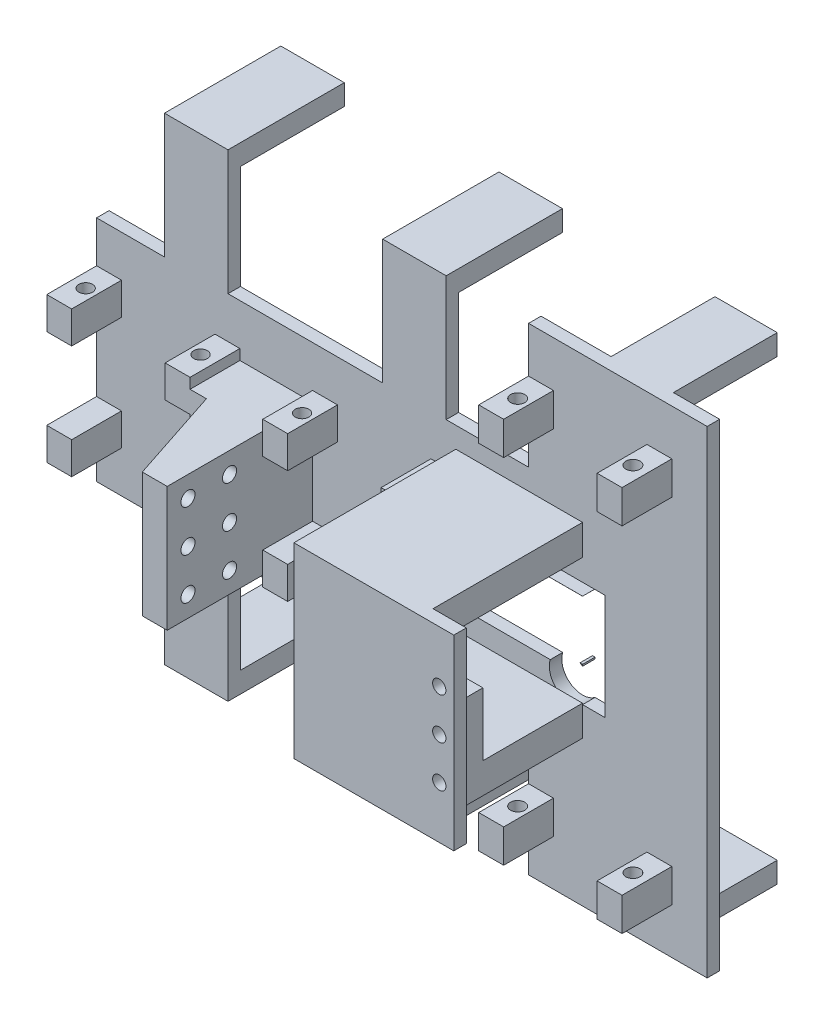
from build123d import *

# Parameters (mm, degrees)
SKETCH1_W                      = 117
SKETCH1_H                      = 3
BOSS_EXTRUDE1_DEPTH            = 22.5
SKETCH2_W                      = 6
SKETCH2_H                      = 4
SKETCH2_H_2                    = 3.739195524
BOSS_EXTRUDE2_DEPTH            = 12
SKETCH4_R                      = 1.65
CUT_EXTRUDE1_DEPTH             = 4
SKETCH5_W                      = 20
SKETCH5_H                      = 3
SKETCH5_W_2                    = 46
SKETCH5_W_3                    = 10.006606548
BOSS_EXTRUDE3_DEPTH            = 5
SKETCH6_W                      = 6
SKETCH6_H                      = 15
BOSS_EXTRUDE4_DEPTH            = 35
BOSS_EXTRUDE5_DEPTH            = 30
SKETCH7_R                      = 1.7
CUT_EXTRUDE2_DEPTH             = 6
CUT_EXTRUDE2_DIRECTION_2_REACH = 88.84
CUT_EXTRUDE3_DEPTH             = 9
BOSS_EXTRUDE6_START            = -5
SKETCH11_W                     = 8
SKETCH11_H                     = 3
BOSS_EXTRUDE6_DEPTH            = 45
CUT_EXTRUDE4_REACH             = 89.07
SKETCH12_R                     = 1.6
SKETCH13_W                     = 24
SKETCH13_H                     = 30.4
CUT_EXTRUDE5_DEPTH             = 30
SKETCH14_W                     = 9.468860996
SKETCH14_H                     = 15.2
SKETCH14_W_2                   = 1.664273207
CUT_EXTRUDE6_DEPTH             = 10
SKETCH15_R                     = 5
CUT_EXTRUDE7_DEPTH             = 3
SKETCH16_R                     = 1.6
CUT_EXTRUDE8_DEPTH             = 4
CUT_EXTRUDE9_REACH             = 89.07
SKETCH17_W                     = 4.98845927
SKETCH17_H                     = 2.1
SKETCH18_W                     = 14
SKETCH18_H                     = 5
BOSS_EXTRUDE7_DEPTH            = 25
SKETCH19_W                     = 15.287657906
SKETCH19_H                     = 3
SKETCH19_W_2                   = 15.287657905
BOSS_EXTRUDE8_DEPTH            = 30
SKETCH20_W                     = 15.287657905
SKETCH20_H                     = 4.97865041
SKETCH20_W_2                   = 15.287657906
BOSS_EXTRUDE9_DEPTH            = 25
SKETCH22_W                     = 3
SKETCH22_H                     = 17.5
SKETCH22_H_2                   = 12
BOSS_EXTRUDE10_DEPTH           = 30
BOSS_EXTRUDE11_REACH           = 122.836
SKETCH23_W                     = 24.559311465
SKETCH23_H                     = 3
SKETCH24_W                     = 43
SKETCH24_H                     = 30.001911063
BOSS_EXTRUDE12_DEPTH           = 3
SKETCH25_W                     = 6
SKETCH25_H                     = 8
BOSS_EXTRUDE13_DEPTH           = 12
SKETCH26_R                     = 1.7
CUT_EXTRUDE10_DEPTH            = 8
SKETCH27_W                     = 15
SKETCH27_H                     = 5
BOSS_EXTRUDE14_DEPTH           = 28
MIRROR3_START                  = -62.501911063
MIRROR3_OUTLINE_W              = 43
MIRROR3_OUTLINE_H              = 3
MIRROR3_DEPTH                  = 30.001911063
MIRROR3_2_OUTLINE_W            = 15
MIRROR3_2_OUTLINE_H            = 25
MIRROR3_2_DEPTH                = 5
MIRROR3_START_2                = -51.5
MIRROR3_3_OUTLINE_W            = 6
MIRROR3_3_OUTLINE_H            = 12
MIRROR3_3_OUTLINE_R            = 1.7
MIRROR3_3_DEPTH                = 8


# Read off the part's stored shape, not the designer's step: Mirror3
with BuildPart() as part:
    # Sketch1 → Boss-Extrude1 (new body)
    with BuildSketch(Plane(origin=(0, 0, 0), x_dir=(1, 0, 0), z_dir=(0, 1, 0))):
        with Locations((2.5, -1.5)):
            Rectangle(SKETCH1_W, SKETCH1_H)
    extrude(amount=BOSS_EXTRUDE1_DEPTH)

    # Sketch2 → Boss-Extrude2 (add)
    with BuildSketch(Plane.XY.offset(3)):
        with Locations((-1, 10.5)):
            Rectangle(SKETCH2_W, SKETCH2_H)
        with Locations((27.5, 10.5)):
            Rectangle(SKETCH2_W, SKETCH2_H)
        with Locations((-24.5, 10.5)):
            Rectangle(SKETCH2_W, SKETCH2_H)
        with Locations((-53, 10.5)):
            Rectangle(SKETCH2_W, SKETCH2_H)
        with Locations((-53, 6.630402238)):
            Rectangle(SKETCH2_W, SKETCH2_H_2)
        with Locations((-24.5, 6.630402238)):
            Rectangle(SKETCH2_W, SKETCH2_H_2)
        with Locations((-1, 6.630402238)):
            Rectangle(SKETCH2_W, SKETCH2_H_2)
        with Locations((27.5, 6.630402238)):
            Rectangle(SKETCH2_W, SKETCH2_H_2)
    extrude(amount=BOSS_EXTRUDE2_DEPTH)

    # Sketch4 → Cut-Extrude1 (cut)
    with BuildSketch(Plane(origin=(0, 12.5, 0), x_dir=(1, 0, 0), z_dir=(0, 1, 0))):
        with Locations(Location((-52.625, -9, 0), (0, 0, 180))):
            Circle(SKETCH4_R)
        with Locations(Location((-24.967056107, -9, 0), (0, 0, 180))):
            Circle(SKETCH4_R)
        with Locations(Location((-0.532943893, -9, 0), (0, 0, 180))):
            Circle(SKETCH4_R)
        with Locations(Location((27.125, -9, 0), (0, 0, 180))):
            Circle(SKETCH4_R)
    extrude(amount=-CUT_EXTRUDE1_DEPTH, mode=Mode.SUBTRACT)

    # Sketch5 → Boss-Extrude3 (add)
    with BuildSketch(Plane(origin=(0, 0, 0), x_dir=(-1, 0, 0), z_dir=(0, -1, 0))):
        with Locations((0, -1.5)):
            Rectangle(SKETCH5_W, SKETCH5_H)
        with Locations((33, -1.5)):
            Rectangle(SKETCH5_W_2, SKETCH5_H)
        with Locations((-15.003303274, -1.5)):
            Rectangle(SKETCH5_W_3, SKETCH5_H)
    extrude(amount=BOSS_EXTRUDE3_DEPTH)

    # Sketch6 → Boss-Extrude4 (add)
    with BuildSketch(Plane.XY.offset(3)):
        with Locations((-7, 2.5)):
            Rectangle(SKETCH6_W, SKETCH6_H)
    extrude(amount=BOSS_EXTRUDE4_DEPTH)

    # Mirror1: part across plane


with BuildPart() as part_1:
    add(part.part)
    add(part.part.mirror(Plane(origin=(0, -5, 0), x_dir=(0, 0, 1), z_dir=(0, -1, 0))))

    # Sketch8 → Boss-Extrude5 (add)
    with BuildSketch(Plane.XZ.offset(20)):
        Polygon((-10, 3), (-10, 38), (-17.557142857, 15), (-21.5, 15), (-21.5, 3), align=None)
    extrude(amount=-BOSS_EXTRUDE5_DEPTH)

    # Sketch7 → Cut-Extrude2 (cut)
    with BuildSketch(Plane.ZY.offset(10)):
        with Locations((23, 5)):
            Circle(SKETCH7_R)
        with Locations((33, 5)):
            Circle(SKETCH7_R)
        with Locations((23, -5)):
            Circle(SKETCH7_R)
        with Locations((33, -5)):
            Circle(SKETCH7_R)
        with Locations((33, -15)):
            Circle(SKETCH7_R)
        with Locations((23, -15)):
            Circle(SKETCH7_R)
    extrude(amount=-CUT_EXTRUDE2_DEPTH, mode=Mode.SUBTRACT)

    # Cut-Extrude2 direction 2: up to this plane
    cut_extrude2_direction_2_end = Plane(origin=(-20.294713575, 10, 6.668263032), z_dir=(-0.9500317490404901, 0, 0.3121532889704468))
    # Sketch7 → Cut-Extrude2 direction 2 (cut, up to the surface)
    with BuildSketch(Plane.ZY.offset(10), mode=Mode.PRIVATE) as cut_extrude2_direction_2_sk1:
        with Locations((23, 5)):
            Circle(SKETCH7_R)
    cut_extrude2_direction_2_tool1 = split(extrude(cut_extrude2_direction_2_sk1.sketch, amount=CUT_EXTRUDE2_DIRECTION_2_REACH, mode=Mode.PRIVATE), bisect_by=cut_extrude2_direction_2_end, keep=Keep.BOTH, mode=Mode.PRIVATE)
    add(cut_extrude2_direction_2_tool1.solids().sort_by_distance((-10, 5, 23))[0], mode=Mode.SUBTRACT)
    # Sketch7 → Cut-Extrude2 direction 2 (cut, up to the surface)
    with BuildSketch(Plane.ZY.offset(10), mode=Mode.PRIVATE) as cut_extrude2_direction_2_sk2:
        with Locations((33, 5)):
            Circle(SKETCH7_R)
    cut_extrude2_direction_2_tool2 = split(extrude(cut_extrude2_direction_2_sk2.sketch, amount=CUT_EXTRUDE2_DIRECTION_2_REACH, mode=Mode.PRIVATE), bisect_by=cut_extrude2_direction_2_end, keep=Keep.BOTH, mode=Mode.PRIVATE)
    add(cut_extrude2_direction_2_tool2.solids().sort_by_distance((-10, 5, 33))[0], mode=Mode.SUBTRACT)
    # Sketch7 → Cut-Extrude2 direction 2 (cut, up to the surface)
    with BuildSketch(Plane.ZY.offset(10), mode=Mode.PRIVATE) as cut_extrude2_direction_2_sk3:
        with Locations((23, -5)):
            Circle(SKETCH7_R)
    cut_extrude2_direction_2_tool3 = split(extrude(cut_extrude2_direction_2_sk3.sketch, amount=CUT_EXTRUDE2_DIRECTION_2_REACH, mode=Mode.PRIVATE), bisect_by=cut_extrude2_direction_2_end, keep=Keep.BOTH, mode=Mode.PRIVATE)
    add(cut_extrude2_direction_2_tool3.solids().sort_by_distance((-10, -5, 23))[0], mode=Mode.SUBTRACT)
    # Sketch7 → Cut-Extrude2 direction 2 (cut, up to the surface)
    with BuildSketch(Plane.ZY.offset(10), mode=Mode.PRIVATE) as cut_extrude2_direction_2_sk4:
        with Locations((33, -5)):
            Circle(SKETCH7_R)
    cut_extrude2_direction_2_tool4 = split(extrude(cut_extrude2_direction_2_sk4.sketch, amount=CUT_EXTRUDE2_DIRECTION_2_REACH, mode=Mode.PRIVATE), bisect_by=cut_extrude2_direction_2_end, keep=Keep.BOTH, mode=Mode.PRIVATE)
    add(cut_extrude2_direction_2_tool4.solids().sort_by_distance((-10, -5, 33))[0], mode=Mode.SUBTRACT)
    # Sketch7 → Cut-Extrude2 direction 2 (cut, up to the surface)
    with BuildSketch(Plane.ZY.offset(10), mode=Mode.PRIVATE) as cut_extrude2_direction_2_sk5:
        with Locations((33, -15)):
            Circle(SKETCH7_R)
    cut_extrude2_direction_2_tool5 = split(extrude(cut_extrude2_direction_2_sk5.sketch, amount=CUT_EXTRUDE2_DIRECTION_2_REACH, mode=Mode.PRIVATE), bisect_by=cut_extrude2_direction_2_end, keep=Keep.BOTH, mode=Mode.PRIVATE)
    add(cut_extrude2_direction_2_tool5.solids().sort_by_distance((-10, -15, 33))[0], mode=Mode.SUBTRACT)
    # Sketch7 → Cut-Extrude2 direction 2 (cut, up to the surface)
    with BuildSketch(Plane.ZY.offset(10), mode=Mode.PRIVATE) as cut_extrude2_direction_2_sk6:
        with Locations((23, -15)):
            Circle(SKETCH7_R)
    cut_extrude2_direction_2_tool6 = split(extrude(cut_extrude2_direction_2_sk6.sketch, amount=CUT_EXTRUDE2_DIRECTION_2_REACH, mode=Mode.PRIVATE), bisect_by=cut_extrude2_direction_2_end, keep=Keep.BOTH, mode=Mode.PRIVATE)
    add(cut_extrude2_direction_2_tool6.solids().sort_by_distance((-10, -15, 23))[0], mode=Mode.SUBTRACT)

    # Sketch10 → Cut-Extrude3 (cut)
    with BuildSketch(Plane.ZY.offset(20)):
        Polygon((26.348631561, 5), (24.674315781, 7.9), (21.325684219, 7.9), (19.651368439, 5), (21.325684219, 2.1), (24.674315781, 2.1), align=None)
        Polygon((36.348631561, 5), (34.674315781, 7.9), (31.325684219, 7.9), (29.651368439, 5), (31.325684219, 2.1), (34.674315781, 2.1), align=None)
        Polygon((36.348631561, -5), (34.674315781, -2.1), (31.325684219, -2.1), (29.651368439, -5), (31.325684219, -7.9), (34.674315781, -7.9), align=None)
        Polygon((26.348631561, -5), (24.674315781, -2.1), (21.325684219, -2.1), (19.651368439, -5), (21.325684219, -7.9), (24.674315781, -7.9), align=None)
        Polygon((34.674315781, -12.1), (36.348631561, -15), (34.674315781, -17.9), (31.325684219, -17.9), (29.651368439, -15), (31.325684219, -12.1), align=None)
        Polygon((24.674315781, -12.1), (26.348631561, -15), (24.674315781, -17.9), (21.325684219, -17.9), (19.651368439, -15), (21.325684219, -12.1), align=None)
    extrude(amount=-CUT_EXTRUDE3_DEPTH, mode=Mode.SUBTRACT)

    # Sketch11 → Boss-Extrude6 (add)
    with BuildSketch(Plane.XZ.offset(32.5).offset(BOSS_EXTRUDE6_START)):
        Polygon((57, 42), (30.5, 15), (30.5, 3), (61, 3), (61, 39), (61, 42), align=None)
        with Locations((65, 40.5)):
            Rectangle(SKETCH11_W, SKETCH11_H)
        Polygon((30.5, 42), (57, 42), (30.5, 15), align=None)
    extrude(amount=-BOSS_EXTRUDE6_DEPTH)

    # Sketch12 → Cut-Extrude4 (cut, up to next)
    with BuildSketch(Plane.XY.offset(42), mode=Mode.PRIVATE) as cut_extrude4_sk1:
        with Locations((65.5, 5)):
            Circle(SKETCH12_R)
    cut_extrude4_tool1 = extrude(cut_extrude4_sk1.sketch, amount=-CUT_EXTRUDE4_REACH, mode=Mode.PRIVATE) & part_1.part
    # Sketch12 → Cut-Extrude4 (cut, up to next)
    with BuildSketch(Plane.XY.offset(42), mode=Mode.PRIVATE) as cut_extrude4_sk2:
        with Locations((65.5, -5)):
            Circle(SKETCH12_R)
    cut_extrude4_tool2 = extrude(cut_extrude4_sk2.sketch, amount=-CUT_EXTRUDE4_REACH, mode=Mode.PRIVATE) & part_1.part
    # Sketch12 → Cut-Extrude4 (cut, up to next)
    with BuildSketch(Plane.XY.offset(42), mode=Mode.PRIVATE) as cut_extrude4_sk3:
        with Locations((65.5, -15)):
            Circle(SKETCH12_R)
    cut_extrude4_tool3 = extrude(cut_extrude4_sk3.sketch, amount=-CUT_EXTRUDE4_REACH, mode=Mode.PRIVATE) & part_1.part
    add(cut_extrude4_tool1.solids().sort_by_distance((65.5, 5, 42))[0], mode=Mode.SUBTRACT)
    add(cut_extrude4_tool2.solids().sort_by_distance((65.5, -5, 42))[0], mode=Mode.SUBTRACT)
    add(cut_extrude4_tool3.solids().sort_by_distance((65.5, -15, 42))[0], mode=Mode.SUBTRACT)

    # Sketch13 → Cut-Extrude5 (cut)
    with BuildSketch(Plane(origin=(61, 0, 0), x_dir=(0, 0, -1), z_dir=(1, 0, 0))):
        with Locations((-15, -5)):
            Rectangle(SKETCH13_W, SKETCH13_H)
    extrude(amount=-CUT_EXTRUDE5_DEPTH, mode=Mode.SUBTRACT)

    # Sketch14 → Cut-Extrude6 (cut)
    with BuildSketch(Plane(origin=(61, 0, 0), x_dir=(0, 0, -1), z_dir=(1, 0, 0))):
        with Locations((-31.734430498, 2.6)):
            Rectangle(SKETCH14_W, SKETCH14_H)
        with Locations((-37.3009976, 2.6)):
            Rectangle(SKETCH14_W_2, SKETCH14_H)
    extrude(amount=-CUT_EXTRUDE6_DEPTH, mode=Mode.SUBTRACT)

    # Sketch15 → Cut-Extrude7 (cut)
    with BuildSketch(Plane(origin=(0, 0, 0), x_dir=(-1, 0, 0), z_dir=(0, 0, -1))):
        with Locations((-34, 6.5)):
            Circle(SKETCH15_R)
        with Locations((-58, -16.5)):
            Circle(SKETCH15_R)
    extrude(amount=-CUT_EXTRUDE7_DEPTH, mode=Mode.SUBTRACT)

    # Sketch16 → Cut-Extrude8 (cut)
    with BuildSketch(Plane(origin=(0, 0, 27), x_dir=(-1, 0, 0), z_dir=(0, 0, -1))):
        with Locations((-58, -16.5)):
            Circle(SKETCH16_R)
        with Locations((-34, 6.5)):
            Circle(SKETCH16_R)
    extrude(amount=-CUT_EXTRUDE8_DEPTH, mode=Mode.SUBTRACT)

    # Sketch17 → Cut-Extrude9 (cut, up to next)
    with BuildSketch(Plane(origin=(0, 0, 0), x_dir=(-1, 0, 0), z_dir=(0, 0, -1)), mode=Mode.PRIVATE) as cut_extrude9_sk1:
        with BuildLine():
            ThreePointArc((-36, 1.917424305), (-36.189338231, 2.004802773), (-36.374868417, 2.1))
            Line((-36.374868417, 2.1), (-61, 2.1))
            Line((-61, 2.1), (-61, 0))
            Line((-61, 0), (-36, 0))
            Line((-36, 0), (-36, 1.917424305))
        make_face()
    cut_extrude9_tool1 = extrude(cut_extrude9_sk1.sketch, amount=-CUT_EXTRUDE9_REACH, mode=Mode.PRIVATE) & part_1.part
    # Sketch17 → Cut-Extrude9 (cut, up to next)
    with BuildSketch(Plane(origin=(0, 0, 0), x_dir=(-1, 0, 0), z_dir=(0, 0, -1)), mode=Mode.PRIVATE) as cut_extrude9_sk2:
        with BuildLine():
            Line((-61, 2.111321556), (-36.395725675, 2.111321556))
            ThreePointArc((-36.395725675, 2.111321556), (-37.862891761, 3.325402823), (-38.769696007, 5))
            Line((-38.769696007, 5), (-61, 5))
            Line((-61, 5), (-61, 2.111321556))
        make_face()
    cut_extrude9_tool2 = extrude(cut_extrude9_sk2.sketch, amount=-CUT_EXTRUDE9_REACH, mode=Mode.PRIVATE) & part_1.part
    # Sketch17 → Cut-Extrude9 (cut, up to next)
    with BuildSketch(Plane(origin=(0, 0, 0), x_dir=(-1, 0, 0), z_dir=(0, 0, -1)), mode=Mode.PRIVATE) as cut_extrude9_sk3:
        with BuildLine():
            ThreePointArc((-31.606750593, 2.109970697), (-33.781071239, 1.50479528), (-36, 1.917424305))
            Line((-36, 1.917424305), (-36, 0))
            Line((-36, 0), (-31.01154073, 0))
            Line((-31.01154073, 0), (-31.01154073, 2.111321556))
            Line((-31.01154073, 2.111321556), (-31.606750593, 2.109970697))
        make_face()
    cut_extrude9_tool3 = extrude(cut_extrude9_sk3.sketch, amount=-CUT_EXTRUDE9_REACH, mode=Mode.PRIVATE) & part_1.part
    # Sketch17 → Cut-Extrude9 (cut, up to next)
    with BuildSketch(Plane(origin=(0, 0, 0), x_dir=(-1, 0, 0), z_dir=(0, 0, -1)), mode=Mode.PRIVATE) as cut_extrude9_sk4:
        with BuildLine():
            Line((-31.01154073, -12.1), (-36, -12.1))
            Line((-36, -12.1), (-55.625131583, -12.1))
            ThreePointArc((-55.625131583, -12.1), (-54.144653037, -13.316244388), (-53.230303993, -15))
            Line((-53.230303993, -15), (-31.01154073, -15))
            Line((-31.01154073, -15), (-31.01154073, -12.1))
        make_face()
    cut_extrude9_tool4 = extrude(cut_extrude9_sk4.sketch, amount=-CUT_EXTRUDE9_REACH, mode=Mode.PRIVATE) & part_1.part
    # Sketch17 → Cut-Extrude9 (cut, up to next)
    with BuildSketch(Plane(origin=(0, 0, 0), x_dir=(-1, 0, 0), z_dir=(0, 0, -1)), mode=Mode.PRIVATE) as cut_extrude9_sk5:
        with Locations((-33.505770365, -11.05)):
            Rectangle(SKETCH17_W, SKETCH17_H)
    cut_extrude9_tool5 = extrude(cut_extrude9_sk5.sketch, amount=-CUT_EXTRUDE9_REACH, mode=Mode.PRIVATE) & part_1.part
    # Sketch17 → Cut-Extrude9 (cut, up to next)
    with BuildSketch(Plane(origin=(0, 0, 0), x_dir=(-1, 0, 0), z_dir=(0, 0, -1)), mode=Mode.PRIVATE) as cut_extrude9_sk6:
        with BuildLine():
            Line((-36, -12.1), (-36, -10))
            Line((-36, -10), (-61, -10))
            Line((-61, -10), (-61, -12.1))
            Line((-61, -12.1), (-60.374868417, -12.1))
            ThreePointArc((-60.374868417, -12.1), (-58, -11.5), (-55.625131583, -12.1))
            Line((-55.625131583, -12.1), (-36, -12.1))
        make_face()
    cut_extrude9_tool6 = extrude(cut_extrude9_sk6.sketch, amount=-CUT_EXTRUDE9_REACH, mode=Mode.PRIVATE) & part_1.part
    add(cut_extrude9_tool1.solids().sort_by_distance((48.508356, 1.049333, 0))[0], mode=Mode.SUBTRACT)
    add(cut_extrude9_tool2.solids().sort_by_distance((49.43945, 3.532185, 0))[0], mode=Mode.SUBTRACT)
    add(cut_extrude9_tool3.solids().sort_by_distance((33.404286, 0.873809, 0))[0], mode=Mode.SUBTRACT)
    add(cut_extrude9_tool4.solids().sort_by_distance((42.569431, -13.526241, 0))[0], mode=Mode.SUBTRACT)
    add(cut_extrude9_tool5.solids().sort_by_distance((33.50577, -11.05, 0))[0], mode=Mode.SUBTRACT)
    add(cut_extrude9_tool6.solids().sort_by_distance((48.138617, -11.019236, 0))[0], mode=Mode.SUBTRACT)


with BuildPart() as cut_extrude9_piece_1:
    # of the separate pieces the step leaves, piece 1, a body of its own (cut_extrude9_pieces)
    add(part_1.part.solids().sort_by_distance((20.006606548, 0, 3))[0])

    # Sketch18 → Boss-Extrude7 (add)
    with BuildSketch(Plane(origin=(0, 0, 0), x_dir=(-1, 0, 0), z_dir=(0, 0, -1))):
        with Locations((-13.041556216, -5)):
            Rectangle(SKETCH18_W, SKETCH18_H)
        with Locations((42, -5)):
            Rectangle(SKETCH18_W, SKETCH18_H)
    extrude(amount=BOSS_EXTRUDE7_DEPTH)

    # Sketch19 → Boss-Extrude8 (add)
    with BuildSketch(Plane(origin=(0, 22.5, 0), x_dir=(1, 0, 0), z_dir=(0, 1, 0))):
        with Locations((-32.007099982, -1.5)):
            Rectangle(SKETCH19_W, SKETCH19_H)
        with Locations((20.516924679, -1.5)):
            Rectangle(SKETCH19_W_2, SKETCH19_H)
    boss_extrude8 = extrude(amount=BOSS_EXTRUDE8_DEPTH)

    # Sketch20 → Boss-Extrude9 (add)
    with BuildSketch(Plane(origin=(0, 0, 0), x_dir=(-1, 0, 0), z_dir=(0, 0, -1))):
        with Locations((-20.516924679, 50.010674795)):
            Rectangle(SKETCH20_W, SKETCH20_H)
        with Locations((32.007099982, 50.010674795)):
            Rectangle(SKETCH20_W_2, SKETCH20_H)
    boss_extrude9 = extrude(amount=BOSS_EXTRUDE9_DEPTH)

    # Mirror2: Boss-Extrude8, Boss-Extrude9 across plane
    add(boss_extrude8.mirror(Plane(origin=(0, -5, 0), x_dir=(0, 0, 1), z_dir=(0, -1, 0))))
    add(boss_extrude9.mirror(Plane(origin=(0, -5, 0), x_dir=(0, 0, 1), z_dir=(0, -1, 0))))

    # Sketch22 → Boss-Extrude10 (add)
    with BuildSketch(Plane(origin=(61, 0, 0), x_dir=(0, 0, -1), z_dir=(1, 0, 0))):
        with Locations((-1.5, 13.75)):
            Rectangle(SKETCH22_W, SKETCH22_H)
        with Locations((-1.5, -26.5)):
            Rectangle(SKETCH22_W, SKETCH22_H_2)
    extrude(amount=BOSS_EXTRUDE10_DEPTH)

    # Sketch23 → Boss-Extrude11 (add, up to next)
    with BuildSketch(Plane.XZ.offset(-5), mode=Mode.PRIVATE) as boss_extrude11_sk1:
        with Locations((78.720344267, 1.5)):
            Rectangle(SKETCH23_W, SKETCH23_H)
    boss_extrude11_tool1 = extrude(boss_extrude11_sk1.sketch, amount=BOSS_EXTRUDE11_REACH, mode=Mode.PRIVATE) - cut_extrude9_piece_1.part
    add(boss_extrude11_tool1.solids().sort_by_distance((78.720344, 5, 1.5))[0])

    # Sketch24 → Boss-Extrude12 (add)
    with BuildSketch(Plane.XY.offset(3)):
        with Locations((69.5, 37.500955531)):
            Rectangle(SKETCH24_W, SKETCH24_H)
    extrude(amount=-BOSS_EXTRUDE12_DEPTH)

    # Sketch25 → Boss-Extrude13 (add)
    with BuildSketch(Plane.XY.offset(3)):
        with Locations((51, 37.5)):
            Rectangle(SKETCH25_W, SKETCH25_H)
        with Locations((79.5, 37.5)):
            Rectangle(SKETCH25_W, SKETCH25_H)
    extrude(amount=BOSS_EXTRUDE13_DEPTH)

    # Sketch26 → Cut-Extrude10 (cut)
    with BuildSketch(Plane(origin=(0, 41.5, 0), x_dir=(1, 0, 0), z_dir=(0, 1, 0))):
        with Locations(Location((51.375, -9, 0), (0, 0, 270))):
            Circle(SKETCH26_R)
        with Locations(Location((79.125, -9, 0), (0, 0, 270))):
            Circle(SKETCH26_R)
    extrude(amount=-CUT_EXTRUDE10_DEPTH, mode=Mode.SUBTRACT)

    # Sketch27 → Boss-Extrude14 (add)
    with BuildSketch(Plane.XY.offset(3)):
        with Locations((72.373095691, 50.001911063)):
            Rectangle(SKETCH27_W, SKETCH27_H)
    extrude(amount=-BOSS_EXTRUDE14_DEPTH)

    # Mirror3 outline → Mirror3 (add)
    with BuildSketch(Plane(origin=(0, 0, 0), x_dir=(1, 0, 0), z_dir=(0, 1, 0)).offset(MIRROR3_START)):
        with Locations((69.5, -1.5)):
            Rectangle(MIRROR3_OUTLINE_W, MIRROR3_OUTLINE_H)
    extrude(amount=MIRROR3_DEPTH)

    # Mirror3 2 outline → Mirror3 2 (add)
    with BuildSketch(Plane(origin=(0, 0, 0), x_dir=(1, 0, 0), z_dir=(0, 1, 0)).offset(MIRROR3_START)):
        with Locations((72.373095691, 12.5)):
            Rectangle(MIRROR3_2_OUTLINE_W, MIRROR3_2_OUTLINE_H)
    extrude(amount=MIRROR3_2_DEPTH)

    # Mirror3 3 outline → Mirror3 3 (add)
    # profile 1 of 2: a face of its own
    with BuildSketch(Plane(origin=(0, 0, 0), x_dir=(1, 0, 0), z_dir=(0, 1, 0)).offset(MIRROR3_START_2)):
        with Locations((51, -9)):
            Rectangle(MIRROR3_3_OUTLINE_W, MIRROR3_3_OUTLINE_H)
        with Locations((51.375, -9)):
            Circle(MIRROR3_3_OUTLINE_R, mode=Mode.SUBTRACT)
    # profile 2 of 2: a face of its own
    with BuildSketch(Plane(origin=(0, 0, 0), x_dir=(1, 0, 0), z_dir=(0, 1, 0)).offset(MIRROR3_START_2)):
        with Locations((79.5, -9)):
            Rectangle(MIRROR3_3_OUTLINE_W, MIRROR3_3_OUTLINE_H)
        with Locations((79.125, -9)):
            Circle(MIRROR3_3_OUTLINE_R, mode=Mode.SUBTRACT)
    extrude(amount=MIRROR3_3_DEPTH)


with BuildPart() as cut_extrude9_piece_2:
    # of the separate pieces the step leaves, piece 2, a body of its own (cut_extrude9_pieces)
    add(part_1.part.solids().sort_by_distance((36.395725675, 2.111321556, 0))[0])


with BuildPart() as cut_extrude9_piece_3:
    # of the separate pieces the step leaves, piece 3, a body of its own (cut_extrude9_pieces)
    add(part_1.part.solids().sort_by_distance((61, -12.1, 0))[0])


solid = Compound([cut_extrude9_piece_1.part, cut_extrude9_piece_2.part, cut_extrude9_piece_3.part])
